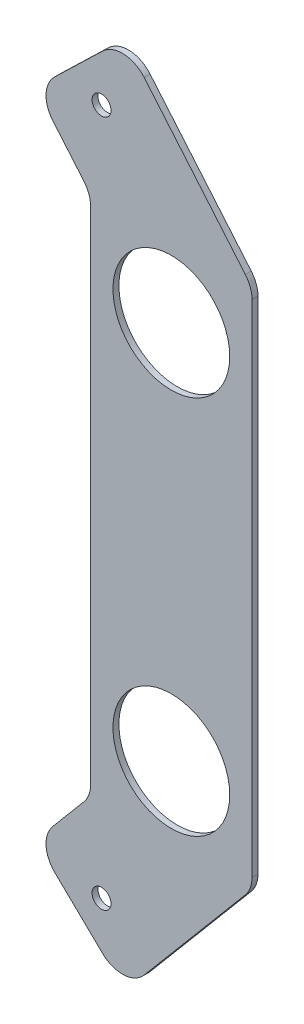
from build123d import *

# Parameters (mm, degrees)
SKETCH1_R           = 15.621
SKETCH1_R_2         = 2.54
BOSS_EXTRUDE1_DEPTH = 1.5875


with BuildPart() as part:
    # Sketch1 → Boss-Extrude1 (new body)
    with BuildSketch(Plane.XY):
        with BuildLine():
            Line((-21.59, 12.7), (-21.59, -117.775079775))
            ThreePointArc((-21.59, -117.775079775), (-22.052256353, -120.388718212), (-23.382941176, -122.685251408))
            Line((-23.382941176, -122.685251408), (-31.735058069, -132.596977529))
            ThreePointArc((-31.735058069, -132.596977529), (-33.518027299, -137.896858051), (-31.202992042, -142.986880112))
            Line((-31.202992042, -142.986880112), (-18.387297428, -155.370519251))
            ThreePointArc((-18.387297428, -155.370519251), (-12.702595742, -157.500816356), (-7.265245808, -154.800959935))
            Line((-7.265245808, -154.800959935), (19.797058824, -122.685251408))
            ThreePointArc((19.797058824, -122.685251408), (21.127743647, -120.388718212), (21.59, -117.775079775))
            Line((21.59, -117.775079775), (21.59, 12.7))
            Line((21.59, 12.7), (21.59, 16.175079775))
            ThreePointArc((21.59, 16.175079775), (21.127743647, 18.788718212), (19.797058824, 21.085251408))
            Line((19.797058824, 21.085251408), (-7.265245808, 53.200959935))
            ThreePointArc((-7.265245808, 53.200959935), (-12.702595742, 55.900816356), (-18.387297428, 53.770519251))
            Line((-18.387297428, 53.770519251), (-31.202992042, 41.386880112))
            ThreePointArc((-31.202992042, 41.386880112), (-33.518027299, 36.296858051), (-31.735058069, 30.996977529))
            Line((-31.735058069, 30.996977529), (-23.382941176, 21.085251408))
            ThreePointArc((-23.382941176, 21.085251408), (-22.052256353, 18.788718212), (-21.59, 16.175079775))
            Line((-21.59, 16.175079775), (-21.59, 12.7))
        make_face()
        Circle(SKETCH1_R, mode=Mode.SUBTRACT)
        with Locations((0, -101.6)):
            Circle(SKETCH1_R, mode=Mode.SUBTRACT)
        with Locations((-18.679891904, -142.72553973)):
            Circle(SKETCH1_R_2, mode=Mode.SUBTRACT)
        with Locations((-18.679891904, 41.12553973)):
            Circle(SKETCH1_R_2, mode=Mode.SUBTRACT)
    extrude(amount=BOSS_EXTRUDE1_DEPTH)


solid = part.part
